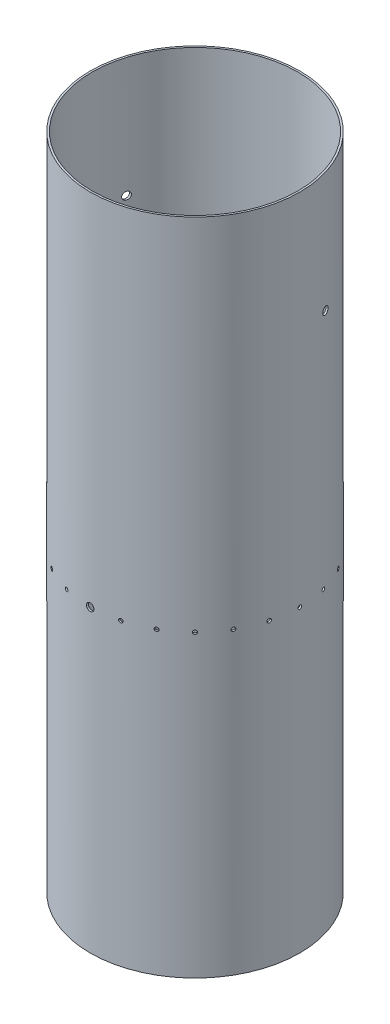
from build123d import *

# Parameters (mm, degrees)
SKETCH1_R               = 88.9
SKETCH1_R_2             = 87.3125
BOSS_EXTRUDE1_DEPTH     = 558.8
SKETCH10_R              = 1.5875
CUT_EXTRUDE1_DEPTH      = 3.81
CIRPATTERN1_COUNT       = 24
CUT_EXTRUDE2_DEPTH      = 594.104957126
CUT_EXTRUDE2_DEPTH_BACK = 594.104957126
SKETCH12_R              = 3.175
CUT_EXTRUDE4_DEPTH      = 573.768592145
CUT_EXTRUDE4_DEPTH_BACK = 573.768592145
SKETCH15_R              = 3.175


with BuildPart() as part:
    # Sketch1 → Boss-Extrude1 (new body)
    with BuildSketch(Plane(origin=(0, 0, 0), x_dir=(1, 0, 0), z_dir=(0, 1, 0))):
        Circle(SKETCH1_R)
        Circle(SKETCH1_R_2, mode=Mode.SUBTRACT)
    extrude(amount=BOSS_EXTRUDE1_DEPTH)

    # Sketch10 → Cut-Extrude1 (cut)
    with BuildSketch(Plane.XY.offset(88.9)):
        with Locations((0, 254)):
            Circle(SKETCH10_R)
    cut_extrude1 = extrude(amount=-CUT_EXTRUDE1_DEPTH, mode=Mode.SUBTRACT)

    # CirPattern1: Cut-Extrude1 ×24 about axis
    cirpattern1_axis = Axis((0, 558.8, 0), (0, -1, 0))
    for i in range(1, CIRPATTERN1_COUNT):
        add(cut_extrude1.rotate(cirpattern1_axis, i * 360 / CIRPATTERN1_COUNT), mode=Mode.SUBTRACT)

    # Sketch12 → Cut-Extrude2 (cut, two sides: drawn at the far end of the back side and taken through both)
    with BuildSketch(Plane.XY.offset(88.9).offset(-CUT_EXTRUDE2_DEPTH_BACK)):
        with Locations((0, 254)):
            Circle(SKETCH12_R)
    extrude(amount=CUT_EXTRUDE2_DEPTH + CUT_EXTRUDE2_DEPTH_BACK, mode=Mode.SUBTRACT)

    # Sketch15 → Cut-Extrude4 (cut, two sides: drawn at the far end of the back side and taken through both)
    with BuildSketch(Plane(origin=(0, 0, 0), x_dir=(0, 0, -1), z_dir=(1, 0, 0)).offset(-CUT_EXTRUDE4_DEPTH_BACK)):
        with Locations((25.4, 457.2)):
            Circle(SKETCH15_R)
    extrude(amount=CUT_EXTRUDE4_DEPTH + CUT_EXTRUDE4_DEPTH_BACK, mode=Mode.SUBTRACT)


solid = part.part
